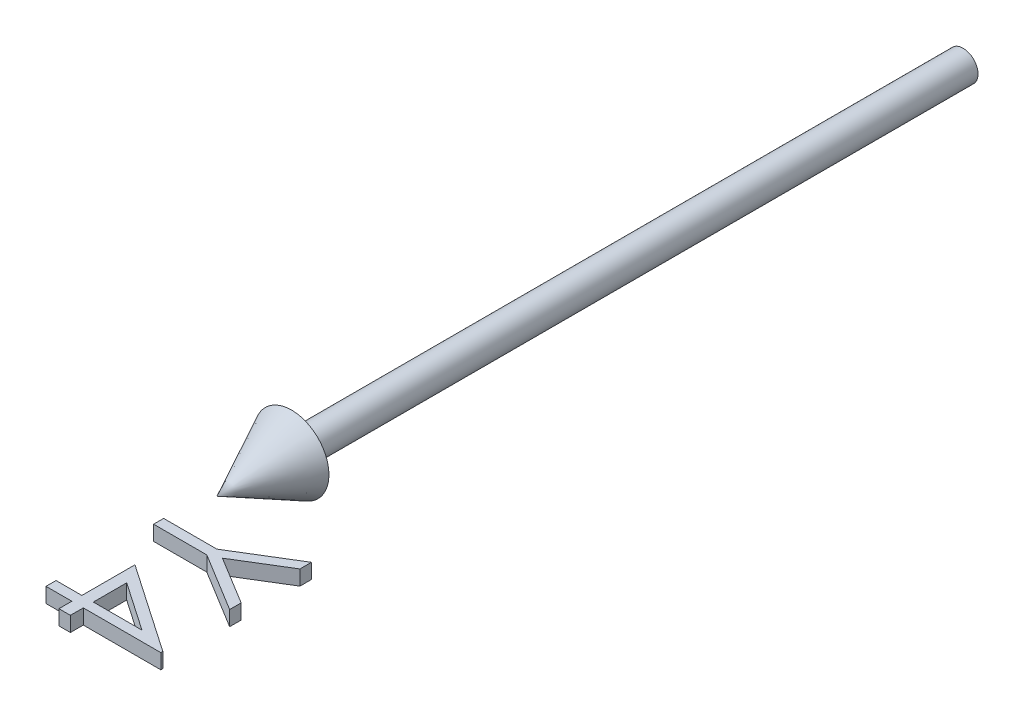
from build123d import *

# Parameters (mm, degrees)
BOSS_EXTRUDE1_DEPTH        = 1
BOSS_EXTRUDE1_DEPTH_BACK   = 1
BOSS_EXTRUDE1_2_DEPTH      = 1
BOSS_EXTRUDE1_2_DEPTH_BACK = 1


with BuildPart() as part:
    # Sketch2 → Revolve1 (revolve)
    with BuildSketch(Plane(origin=(0, 0, 0), x_dir=(1, 0, 0), z_dir=(0, 1, 0))):
        Polygon((0, -100), (5, -90), (2, -90), (2, 0), (0, 0), align=None)
    revolve(axis=Axis((0, 0, -41.949952025), (0, 0, 1)))


with BuildPart() as body_2:
    # Sketch3 → Boss-Extrude1 (new, two sides: drawn at the far end of the back side and taken through both)
    with BuildSketch(Plane(origin=(0, 0, 0), x_dir=(1, 0, 0), z_dir=(0, 1, 0)).offset(-BOSS_EXTRUDE1_DEPTH_BACK)):
        Polygon((15, -102.339799406), (15, -103.881265752), (8.5546875, -107.823573444), (15, -111.759871521), (15, -113.301337867), (7.130408654, -108.49364556), (0, -108.49364556), (0, -107.147491713), (7.130408654, -107.147491713), align=None)
    extrude(amount=BOSS_EXTRUDE1_DEPTH + BOSS_EXTRUDE1_DEPTH_BACK)


with BuildPart() as body_3:
    # Sketch3 → Boss-Extrude1 2 (new, two sides: drawn at the far end of the back side and taken through both)
    with BuildSketch(Plane(origin=(0, 0, 0), x_dir=(1, 0, 0), z_dir=(0, 1, 0)).offset(-BOSS_EXTRUDE1_2_DEPTH_BACK)):
        Polygon((15.384615385, -122.643284983), (15.384615385, -122.916722483), (5, -122.916722483), (5, -124.647491713), (3.461538462, -124.647491713), (3.461538462, -122.916722483), (0, -122.916722483), (0, -121.570568637), (3.461538462, -121.570568637), (3.461538462, -114.455184021), align=None)
        Polygon((5, -121.570568637), (11.514423077, -121.570568637), (5, -117.09941479), align=None, mode=Mode.SUBTRACT)
    extrude(amount=BOSS_EXTRUDE1_2_DEPTH + BOSS_EXTRUDE1_2_DEPTH_BACK)


solid = Compound([part.part, body_2.part, body_3.part])
